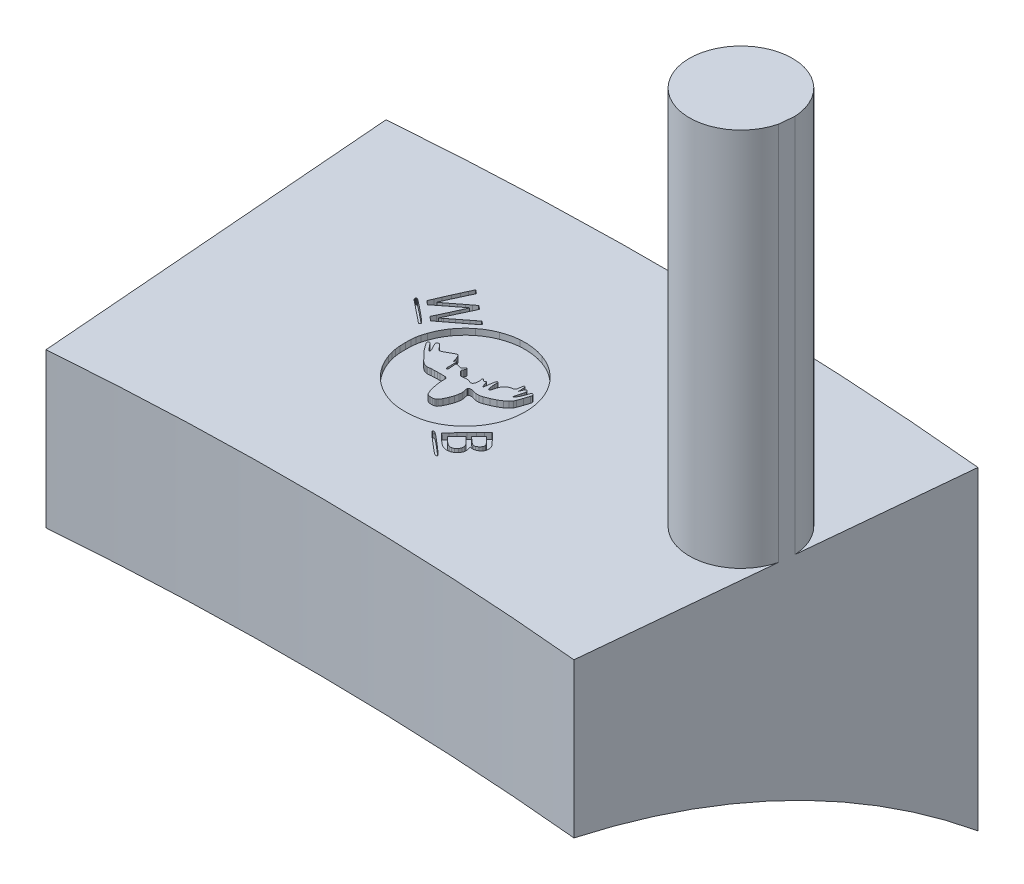
from build123d import *

# Parameters (mm, degrees)
SKETCH1_R           = 140.97
SKETCH1_R_2         = 125.73
BOSS_EXTRUDE1_DEPTH = 12.954
CUT_EXTRUDE1_START  = -12.954
CUT_EXTRUDE1_DEPTH  = 12.954
SKETCH5_R           = 2.1209
BOSS_EXTRUDE2_DEPTH = 28.575
SKETCH6_W           = 35.941656598
SKETCH6_H           = 50
CUT_EXTRUDE2_DEPTH  = 25.4
CUT_EXTRUDE3_DEPTH  = 0.25


with BuildPart() as part:
    # Sketch1 → Boss-Extrude1 (new body)
    with BuildSketch(Plane(origin=(0, 0, 0), x_dir=(1, 0, 0), z_dir=(0, 1, 0))):
        Circle(SKETCH1_R)
        Circle(SKETCH1_R_2, mode=Mode.SUBTRACT)
    extrude(amount=BOSS_EXTRUDE1_DEPTH)

    # Sketch3 → Cut-Extrude1 (cut)
    with BuildSketch(Plane(origin=(0, 12.954, 0), x_dir=(1, 0, 0), z_dir=(0, 1, 0)).offset(CUT_EXTRUDE1_START)):
        with BuildLine():
            Line((0, 0), (-11.080200404, 140.53387513))
            ThreePointArc((-11.080200404, 140.53387513), (-1.210297371, -140.964804403), (13.491584054, 140.322906397))
            Line((13.491584054, 140.322906397), (0, 0))
        make_face()
    extrude(amount=CUT_EXTRUDE1_DEPTH, mode=Mode.SUBTRACT)

    # Sketch5 → Boss-Extrude2 (add)
    with BuildSketch(Plane(origin=(0, 0, 0), x_dir=(1, 0, 0), z_dir=(0, 1, 0))):
        with Locations((10.71230924, 133.345085246)):
            Circle(SKETCH5_R)
    extrude(amount=BOSS_EXTRUDE2_DEPTH)

    # Sketch2 → Cut-Revolve1 (revolve, cut)
    with BuildSketch(Plane.XY):
        with BuildLine():
            Line((-125.73, 6.604), (-125.73, 0))
            Line((-125.73, 0), (-140.97, 0))
            ThreePointArc((-140.97, 0), (-133.78949329, 4.316215284), (-125.73, 6.604))
        make_face()
    revolve(axis=Axis((0, 0, 0), (0, 1, 0)), mode=Mode.SUBTRACT)

    # Sketch6 → Cut-Extrude2 (cut)
    with BuildSketch(Plane(origin=(0, 0, 0), x_dir=(0.09570535612916914, 0, -0.9954097070092239), z_dir=(0.995409707009224, 0, 0.09570535612916914))):
        with Locations((132.91957607, 23.563430101)):
            Rectangle(SKETCH6_W, SKETCH6_H)
    extrude(amount=CUT_EXTRUDE2_DEPTH, mode=Mode.SUBTRACT)

    # Sketch7 → Cut-Extrude3 (cut)
    # profile 1 of 5: a face of its own
    with BuildSketch(Plane(origin=(0, 12.954, 0), x_dir=(1, 0, 0), z_dir=(0, 1, 0))):
        with BuildLine():
            Line((-3.705322749, 134.849056941), (-3.634126589, 134.792668549))
            Line((-3.634126589, 134.792668549), (-3.160347996, 135.161889223))
            Line((-3.160347996, 135.161889223), (-2.977161715, 135.304652612))
            Line((-2.977161715, 135.304652612), (-2.819274394, 135.427709401))
            Line((-2.819274394, 135.427709401), (-2.681545143, 135.535061604))
            Line((-2.681545143, 135.535061604), (-2.664549669, 135.548331107))
            ThreePointArc((-2.664549669, 135.548331107), (-2.659148698, 135.548333677), (-2.657831229, 135.543095856))
            ThreePointArc((-2.657831229, 135.543095856), (-2.716026654, 135.411683388), (-2.774453274, 135.280373548))
            ThreePointArc((-2.774453274, 135.280373548), (-2.84330035, 135.127328835), (-2.913125798, 134.974728012))
            ThreePointArc((-2.913125798, 134.974728012), (-2.996713918, 134.794502631), (-3.080999908, 134.614602566))
            Line((-3.080999908, 134.614602566), (-3.169252964, 134.427181418))
            Line((-3.169252964, 134.427181418), (-3.082744205, 134.354752187))
            Line((-3.082744205, 134.354752187), (-2.996235446, 134.282322957))
            Line((-2.996235446, 134.282322957), (-2.419881036, 134.722244367))
            ThreePointArc((-2.419881036, 134.722244367), (-2.308383462, 134.807458989), (-2.196992664, 134.892813139))
            ThreePointArc((-2.196992664, 134.892813139), (-2.100802582, 134.966762842), (-2.004755402, 135.040898053))
            ThreePointArc((-2.004755402, 135.040898053), (-1.921450772, 135.105365412), (-1.838184063, 135.169881744))
            ThreePointArc((-1.838184063, 135.169881744), (-1.826822545, 135.17924269), (-1.816036102, 135.189260877))
            ThreePointArc((-1.816036102, 135.189260877), (-1.809296654, 135.197167451), (-1.804023567, 135.20611891))
            ThreePointArc((-1.804023567, 135.20611891), (-1.802331284, 135.213430449), (-1.803887086, 135.22077224))
            ThreePointArc((-1.803887086, 135.22077224), (-1.809327945, 135.230116448), (-1.816522006, 135.238188788))
            ThreePointArc((-1.816522006, 135.238188788), (-1.834417714, 135.254224445), (-1.852690135, 135.269829484))
            ThreePointArc((-1.852690135, 135.269829484), (-1.865372858, 135.28020644), (-1.878243989, 135.29034876))
            ThreePointArc((-1.878243989, 135.29034876), (-1.889989756, 135.29919486), (-1.901956271, 135.307739981))
            ThreePointArc((-1.901956271, 135.307739981), (-1.912002633, 135.314585535), (-1.922174507, 135.321243161))
            ThreePointArc((-1.922174507, 135.321243161), (-1.926080577, 135.323066893), (-1.930329315, 135.323796005))
            ThreePointArc((-1.930329315, 135.323796005), (-1.93541936, 135.323106049), (-1.939982063, 135.320746737))
            ThreePointArc((-1.939982063, 135.320746737), (-2.002559306, 135.273289257), (-2.065101319, 135.225785357))
            ThreePointArc((-2.065101319, 135.225785357), (-2.135557248, 135.171957252), (-2.205749551, 135.117785825))
            ThreePointArc((-2.205749551, 135.117785825), (-2.288060267, 135.053741944), (-2.370177709, 134.989450434))
            ThreePointArc((-2.370177709, 134.989450434), (-2.454315753, 134.923404554), (-2.538485093, 134.857398562))
            ThreePointArc((-2.538485093, 134.857398562), (-2.614951264, 134.797501817), (-2.691455274, 134.737653411))
            Line((-2.691455274, 134.737653411), (-2.818347825, 134.638541366))
            ThreePointArc((-2.818347825, 134.638541366), (-2.841702758, 134.620425916), (-2.865179269, 134.602468304))
            Line((-2.865179269, 134.602468304), (-2.933826793, 134.550324423))
            Line((-2.933826793, 134.550324423), (-2.871839825, 134.68529859))
            ThreePointArc((-2.871839825, 134.68529859), (-2.853901576, 134.72425615), (-2.835885824, 134.76317793))
            Line((-2.835885824, 134.76317793), (-2.767776986, 134.909805204))
            Line((-2.767776986, 134.909805204), (-2.687753865, 135.08175565))
            Line((-2.687753865, 135.08175565), (-2.604649551, 135.259993198))
            Line((-2.604649551, 135.259993198), (-2.399457086, 135.699689992))
            Line((-2.399457086, 135.699689992), (-2.469705309, 135.759131745))
            ThreePointArc((-2.469705309, 135.759131745), (-2.4835554, 135.770647702), (-2.497602089, 135.781923021))
            ThreePointArc((-2.497602089, 135.781923021), (-2.51033253, 135.791713922), (-2.523297134, 135.801192578))
            ThreePointArc((-2.523297134, 135.801192578), (-2.534188146, 135.808816333), (-2.545206093, 135.816255461))
            ThreePointArc((-2.545206093, 135.816255461), (-2.549168326, 135.81814077), (-2.553499159, 135.81884615))
            ThreePointArc((-2.553499159, 135.81884615), (-2.558628744, 135.818086803), (-2.56322549, 135.815686975))
            ThreePointArc((-2.56322549, 135.815686975), (-2.633699992, 135.762276212), (-2.704143397, 135.708824441))
            ThreePointArc((-2.704143397, 135.708824441), (-2.783303168, 135.648454262), (-2.862204439, 135.587746622))
            ThreePointArc((-2.862204439, 135.587746622), (-2.954849432, 135.515954249), (-3.047305436, 135.443918653))
            ThreePointArc((-3.047305436, 135.443918653), (-3.139493609, 135.372071791), (-3.23185094, 135.300442507))
            ThreePointArc((-3.23185094, 135.300442507), (-3.312973781, 135.237943632), (-3.394350982, 135.175776311))
            Line((-3.394350982, 135.175776311), (-3.528322202, 135.073862499))
            ThreePointArc((-3.528322202, 135.073862499), (-3.530734929, 135.07313885), (-3.533028228, 135.074180819))
            ThreePointArc((-3.533028228, 135.074180819), (-3.53428324, 135.07657134), (-3.533958776, 135.079251707))
            Line((-3.533958776, 135.079251707), (-3.464140959, 135.234582289))
            ThreePointArc((-3.464140959, 135.234582289), (-3.421585617, 135.328778761), (-3.378671475, 135.422812312))
            ThreePointArc((-3.378671475, 135.422812312), (-3.329420779, 135.529875573), (-3.279933201, 135.636829547))
            Line((-3.279933201, 135.636829547), (-3.02134553, 136.194077419))
            Line((-3.02134553, 136.194077419), (-3.090680372, 136.254012664))
            ThreePointArc((-3.090680372, 136.254012664), (-3.104288318, 136.265597751), (-3.118069365, 136.276976379))
            ThreePointArc((-3.118069365, 136.276976379), (-3.130419138, 136.286795346), (-3.142980655, 136.296341933))
            ThreePointArc((-3.142980655, 136.296341933), (-3.153566633, 136.30409529), (-3.164256708, 136.311704481))
            ThreePointArc((-3.164256708, 136.311704481), (-3.16763544, 136.313373722), (-3.171360022, 136.313947909))
            ThreePointArc((-3.171360022, 136.313947909), (-3.175222698, 136.312820985), (-3.177873413, 136.309793786))
            Line((-3.177873413, 136.309793786), (-3.269763803, 136.112211535))
            ThreePointArc((-3.269763803, 136.112211535), (-3.32092752, 136.001467527), (-3.371619222, 135.890506667))
            ThreePointArc((-3.371619222, 135.890506667), (-3.431189622, 135.758922808), (-3.490420605, 135.627185816))
            ThreePointArc((-3.490420605, 135.627185816), (-3.549299626, 135.495030194), (-3.607618576, 135.362626464))
            ThreePointArc((-3.607618576, 135.362626464), (-3.656483193, 135.249991703), (-3.704569703, 135.137022559))
            ThreePointArc((-3.704569703, 135.137022559), (-3.746574227, 135.037228104), (-3.788463362, 134.937385159))
            ThreePointArc((-3.788463362, 134.937385159), (-3.789644845, 134.930022177), (-3.787327306, 134.92293427))
            ThreePointArc((-3.787327306, 134.92293427), (-3.783688065, 134.917805921), (-3.779427776, 134.913180558))
            ThreePointArc((-3.779427776, 134.913180558), (-3.769174514, 134.903523136), (-3.758779625, 134.894018325))
            ThreePointArc((-3.758779625, 134.894018325), (-3.746174728, 134.88286181), (-3.733375686, 134.87192857))
            ThreePointArc((-3.733375686, 134.87192857), (-3.719430125, 134.86039352), (-3.705322749, 134.849056941))
        make_face()
    # profile 2 of 5: a face of its own
    with BuildSketch(Plane(origin=(0, 12.954, 0), x_dir=(1, 0, 0), z_dir=(0, 1, 0))):
        with BuildLine():
            Line((2.335946386, 130.532415257), (2.309368832, 130.596024339))
            Line((2.309368832, 130.596024339), (2.404672543, 130.585560291))
            ThreePointArc((2.404672543, 130.585560291), (2.448008969, 130.583769831), (2.491187442, 130.587877266))
            ThreePointArc((2.491187442, 130.587877266), (2.533564282, 130.597811455), (2.57422292, 130.613347218))
            ThreePointArc((2.57422292, 130.613347218), (2.614128208, 130.634961314), (2.650944997, 130.661496671))
            ThreePointArc((2.650944997, 130.661496671), (2.686708775, 130.694228496), (2.718838126, 130.730534487))
            ThreePointArc((2.718838126, 130.730534487), (2.733969509, 130.750629269), (2.74801809, 130.771495423))
            ThreePointArc((2.74801809, 130.771495423), (2.757136164, 130.787998593), (2.764165236, 130.805493908))
            ThreePointArc((2.764165236, 130.805493908), (2.769111119, 130.824011448), (2.771817407, 130.842986091))
            ThreePointArc((2.771817407, 130.842986091), (2.773344497, 130.869210372), (2.773619979, 130.895477635))
            ThreePointArc((2.773619979, 130.895477635), (2.772759833, 130.916159469), (2.770734702, 130.936759881))
            ThreePointArc((2.770734702, 130.936759881), (2.767410036, 130.959044917), (2.763113119, 130.981163071))
            ThreePointArc((2.763113119, 130.981163071), (2.758106921, 131.001965594), (2.752174547, 131.02252317))
            ThreePointArc((2.752174547, 131.02252317), (2.746367141, 131.038591271), (2.739185953, 131.054094187))
            ThreePointArc((2.739185953, 131.054094187), (2.717287586, 131.090229767), (2.690721807, 131.123086698))
            ThreePointArc((2.690721807, 131.123086698), (2.592426633, 131.228478429), (2.493479088, 131.333257917))
            ThreePointArc((2.493479088, 131.333257917), (2.388177952, 131.44378386), (2.282587159, 131.554033112))
            ThreePointArc((2.282587159, 131.554033112), (2.268428011, 131.563808495), (2.25157004, 131.567250647))
            ThreePointArc((2.25157004, 131.567250647), (2.247090484, 131.566358043), (2.243295201, 131.563816589))
            Line((2.243295201, 131.563816589), (2.093772156, 131.413891952))
            ThreePointArc((2.093772156, 131.413891952), (2.010221188, 131.329749051), (1.926976453, 131.245303173))
            ThreePointArc((1.926976453, 131.245303173), (1.829018897, 131.145349226), (1.731283032, 131.045178497))
            ThreePointArc((1.731283032, 131.045178497), (1.633863636, 130.944697957), (1.536858239, 130.84381768))
            ThreePointArc((1.536858239, 130.84381768), (1.455212176, 130.757981851), (1.374147358, 130.671596873))
            ThreePointArc((1.374147358, 130.671596873), (1.302808659, 130.594982255), (1.231547684, 130.518295339))
            ThreePointArc((1.231547684, 130.518295339), (1.228715686, 130.51274475), (1.22922052, 130.506533921))
            ThreePointArc((1.22922052, 130.506533921), (1.232151217, 130.500673), (1.236250836, 130.495561005))
            ThreePointArc((1.236250836, 130.495561005), (1.265276066, 130.466421967), (1.294381493, 130.437363032))
            ThreePointArc((1.294381493, 130.437363032), (1.328355225, 130.403801226), (1.362591167, 130.370506938))
            ThreePointArc((1.362591167, 130.370506938), (1.402373559, 130.332316835), (1.442350507, 130.294330437))
            ThreePointArc((1.442350507, 130.294330437), (1.521848226, 130.221328603), (1.603427718, 130.150660777))
            ThreePointArc((1.603427718, 130.150660777), (1.661031646, 130.106499752), (1.722394759, 130.067731504))
            ThreePointArc((1.722394759, 130.067731504), (1.77376172, 130.042719104), (1.827938544, 130.024579187))
            ThreePointArc((1.827938544, 130.024579187), (1.883996554, 130.013623643), (1.941002271, 130.010035784))
            ThreePointArc((1.941002271, 130.010035784), (1.963533572, 130.010675147), (1.986000631, 130.012491622))
            ThreePointArc((1.986000631, 130.012491622), (2.010070047, 130.015584443), (2.03398864, 130.01968362))
            ThreePointArc((2.03398864, 130.01968362), (2.056663325, 130.024568389), (2.079107226, 130.030422757))
            ThreePointArc((2.079107226, 130.030422757), (2.09735732, 130.036355934), (2.115108927, 130.043646267))
            ThreePointArc((2.115108927, 130.043646267), (2.148059247, 130.061185288), (2.178596864, 130.082651418))
            ThreePointArc((2.178596864, 130.082651418), (2.215063858, 130.113633203), (2.24962219, 130.146730548))
            ThreePointArc((2.24962219, 130.146730548), (2.281607235, 130.18123038), (2.311493501, 130.217563459))
            ThreePointArc((2.311493501, 130.217563459), (2.330465585, 130.246215265), (2.345014512, 130.277347158))
            ThreePointArc((2.345014512, 130.277347158), (2.35364471, 130.305134714), (2.358761057, 130.333778241))
            ThreePointArc((2.358761057, 130.333778241), (2.361416451, 130.3681767), (2.361485094, 130.402677431))
            ThreePointArc((2.361485094, 130.402677431), (2.358930096, 130.43779288), (2.353779371, 130.472622361))
            ThreePointArc((2.353779371, 130.472622361), (2.346447858, 130.502991523), (2.335946386, 130.532415257))
        make_face()
        with BuildLine():
            Line((2.09650021, 130.885826141), (1.973628318, 131.001626652))
            Line((1.973628318, 131.001626652), (2.016395962, 131.050769077))
            ThreePointArc((2.016395962, 131.050769077), (2.051337182, 131.090177316), (2.087000561, 131.128933237))
            ThreePointArc((2.087000561, 131.128933237), (2.129160629, 131.173380489), (2.171841342, 131.21732803))
            ThreePointArc((2.171841342, 131.21732803), (2.215204993, 131.261333373), (2.258690635, 131.305218169))
            ThreePointArc((2.258690635, 131.305218169), (2.264700287, 131.309254456), (2.271799364, 131.310672418))
            ThreePointArc((2.271799364, 131.310672418), (2.275742106, 131.309923313), (2.279135375, 131.307780396))
            ThreePointArc((2.279135375, 131.307780396), (2.298697416, 131.289439265), (2.318179783, 131.271013524))
            ThreePointArc((2.318179783, 131.271013524), (2.340698195, 131.249353418), (2.362943141, 131.227412556))
            ThreePointArc((2.362943141, 131.227412556), (2.388541194, 131.201640097), (2.413931992, 131.175663427))
            ThreePointArc((2.413931992, 131.175663427), (2.47456052, 131.110071795), (2.53198688, 131.041659123))
            ThreePointArc((2.53198688, 131.041659123), (2.558135178, 130.999358305), (2.57340656, 130.952030959))
            ThreePointArc((2.57340656, 130.952030959), (2.573698192, 130.911851785), (2.559507846, 130.87426076))
            ThreePointArc((2.559507846, 130.87426076), (2.527310107, 130.828951161), (2.488882764, 130.788789072))
            ThreePointArc((2.488882764, 130.788789072), (2.448321254, 130.758066595), (2.403077964, 130.734782451))
            ThreePointArc((2.403077964, 130.734782451), (2.362793058, 130.725307263), (2.321556939, 130.728805168))
            ThreePointArc((2.321556939, 130.728805168), (2.272395823, 130.74650711), (2.227905298, 130.773907241))
            ThreePointArc((2.227905298, 130.773907241), (2.160795261, 130.828214139), (2.09650021, 130.885826141))
        make_face(mode=Mode.SUBTRACT)
        with BuildLine():
            Line((1.608075251, 130.373386998), (1.47366335, 130.502226889))
            Line((1.47366335, 130.502226889), (1.665668252, 130.695587312))
            Line((1.665668252, 130.695587312), (1.85767323, 130.888947774))
            Line((1.85767323, 130.888947774), (1.965556938, 130.783670016))
            ThreePointArc((1.965556938, 130.783670016), (1.988333684, 130.761079939), (2.010741039, 130.738123412))
            ThreePointArc((2.010741039, 130.738123412), (2.034185105, 130.713379009), (2.057292449, 130.688319873))
            ThreePointArc((2.057292449, 130.688319873), (2.078136199, 130.665089613), (2.098660506, 130.641576646))
            ThreePointArc((2.098660506, 130.641576646), (2.112823257, 130.624500264), (2.126348042, 130.606914289))
            ThreePointArc((2.126348042, 130.606914289), (2.154041134, 130.560672751), (2.17223968, 130.509938146))
            ThreePointArc((2.17223968, 130.509938146), (2.178810975, 130.459652494), (2.173556842, 130.409212204))
            ThreePointArc((2.173556842, 130.409212204), (2.15635814, 130.359030252), (2.128666025, 130.313784584))
            ThreePointArc((2.128666025, 130.313784584), (2.088669818, 130.269679109), (2.04231946, 130.232307544))
            ThreePointArc((2.04231946, 130.232307544), (1.997906914, 130.208591409), (1.949382298, 130.195164161))
            ThreePointArc((1.949382298, 130.195164161), (1.900283624, 130.193138123), (1.852080906, 130.202692313))
            ThreePointArc((1.852080906, 130.202692313), (1.794663546, 130.226718162), (1.741950822, 130.259814435))
            ThreePointArc((1.741950822, 130.259814435), (1.673288951, 130.314568422), (1.608075251, 130.373386998))
        make_face(mode=Mode.SUBTRACT)
    # profile 3 of 5: a face of its own
    with BuildSketch(Plane(origin=(0, 12.954, 0), x_dir=(1, 0, 0), z_dir=(0, 1, 0))):
        with BuildLine():
            ThreePointArc((-0.478163902, 135.451211087), (-0.832196614, 135.396802924), (-1.174314339, 135.290713945))
            ThreePointArc((-1.174314339, 135.290713945), (-1.499897181, 135.134586011), (-1.799566273, 134.933144819))
            ThreePointArc((-1.799566273, 134.933144819), (-2.067166133, 134.69051804), (-2.29700334, 134.411856423))
            ThreePointArc((-2.29700334, 134.411856423), (-2.482397083, 134.104962374), (-2.620553748, 133.774103594))
            ThreePointArc((-2.620553748, 133.774103594), (-2.652636616, 133.672719633), (-2.681633736, 133.570410371))
            ThreePointArc((-2.681633736, 133.570410371), (-2.701872906, 133.485459703), (-2.717471978, 133.399535849))
            ThreePointArc((-2.717471978, 133.399535849), (-2.728871598, 133.310002112), (-2.735638285, 133.219999594))
            ThreePointArc((-2.735638285, 133.219999594), (-2.739936879, 133.103832239), (-2.741386884, 132.987594423))
            ThreePointArc((-2.741386884, 132.987594423), (-2.739612552, 132.869476936), (-2.734239659, 132.751468373))
            ThreePointArc((-2.734239659, 132.751468373), (-2.725667506, 132.651200798), (-2.712184909, 132.551474733))
            ThreePointArc((-2.712184909, 132.551474733), (-2.694493464, 132.456934765), (-2.671900459, 132.363444932))
            ThreePointArc((-2.671900459, 132.363444932), (-2.642716818, 132.263312613), (-2.609470226, 132.164454985))
            ThreePointArc((-2.609470226, 132.164454985), (-2.499781383, 131.905783625), (-2.361759947, 131.661053981))
            ThreePointArc((-2.361759947, 131.661053981), (-2.196923821, 131.432878792), (-2.007670003, 131.224509269))
            ThreePointArc((-2.007670003, 131.224509269), (-1.797128232, 131.039309846), (-1.567170962, 130.878853254))
            ThreePointArc((-1.567170962, 130.878853254), (-1.322686887, 130.746722358), (-1.064628428, 130.643587162))
            ThreePointArc((-1.064628428, 130.643587162), (-0.967352396, 130.613024117), (-0.869030926, 130.58601273))
            ThreePointArc((-0.869030926, 130.58601273), (-0.779102808, 130.565385207), (-0.688272992, 130.54918318))
            ThreePointArc((-0.688272992, 130.54918318), (-0.593644862, 130.536942329), (-0.498547668, 130.529142001))
            ThreePointArc((-0.498547668, 130.529142001), (-0.386869757, 130.524243932), (-0.275096418, 130.52261071))
            ThreePointArc((-0.275096418, 130.52261071), (-0.026318267, 130.533992849), (0.220381216, 130.56804408))
            ThreePointArc((0.220381216, 130.56804408), (0.451881811, 130.623520564), (0.676321172, 130.702875079))
            ThreePointArc((0.676321172, 130.702875079), (0.890810324, 130.805064869), (1.093421652, 130.929149514))
            ThreePointArc((1.093421652, 130.929149514), (1.290879506, 131.078712437), (1.47366335, 131.245891198))
            ThreePointArc((1.47366335, 131.245891198), (1.630567102, 131.418122692), (1.771429406, 131.603703633))
            ThreePointArc((1.771429406, 131.603703633), (1.891273566, 131.796544655), (1.991918332, 132.00006594))
            ThreePointArc((1.991918332, 132.00006594), (2.072576187, 132.212711466), (2.132344697, 132.432146044))
            ThreePointArc((2.132344697, 132.432146044), (2.172707651, 132.662718817), (2.192502341, 132.895959341))
            ThreePointArc((2.192502341, 132.895959341), (2.158400825, 133.415036137), (2.015890216, 133.91533041))
            ThreePointArc((2.015890216, 133.91533041), (1.771362965, 134.374367415), (1.435716786, 134.771671067))
            ThreePointArc((1.435716786, 134.771671067), (1.023249238, 135.090238317), (0.553133934, 135.315196475))
            ThreePointArc((0.553133934, 135.315196475), (0.044635512, 135.437420686), (-0.478163902, 135.451211087))
        make_face()
        with BuildLine():
            Line((1.317883636, 133.728388796), (1.327047219, 133.57405895))
            Line((1.327047219, 133.57405895), (1.361694562, 133.665692843))
            ThreePointArc((1.361694562, 133.665692843), (1.380423856, 133.712968368), (1.400629237, 133.759632105))
            ThreePointArc((1.400629237, 133.759632105), (1.412841844, 133.779536966), (1.429631282, 133.795768602))
            ThreePointArc((1.429631282, 133.795768602), (1.443775304, 133.800534829), (1.457989499, 133.795982148))
            ThreePointArc((1.457989499, 133.795982148), (1.475700354, 133.780445011), (1.490245543, 133.761910868))
            ThreePointArc((1.490245543, 133.761910868), (1.49772684, 133.747806897), (1.502712863, 133.732640112))
            ThreePointArc((1.502712863, 133.732640112), (1.505181933, 133.716551964), (1.505046827, 133.700276012))
            ThreePointArc((1.505046827, 133.700276012), (1.501935294, 133.675951412), (1.496955412, 133.651939569))
            ThreePointArc((1.496955412, 133.651939569), (1.484716204, 133.603764821), (1.471931594, 133.555731933))
            ThreePointArc((1.471931594, 133.555731933), (1.445764659, 133.459029329), (1.419895886, 133.362246537))
            ThreePointArc((1.419895886, 133.362246537), (1.412166515, 133.329825502), (1.4061064, 133.297051402))
            ThreePointArc((1.4061064, 133.297051402), (1.406447734, 133.285595058), (1.41095155, 133.27505561))
            ThreePointArc((1.41095155, 133.27505561), (1.418115987, 133.270025868), (1.426802953, 133.271104782))
            ThreePointArc((1.426802953, 133.271104782), (1.448171255, 133.286512271), (1.464724996, 133.307005409))
            ThreePointArc((1.464724996, 133.307005409), (1.492183822, 133.354147431), (1.51785903, 133.402284122))
            ThreePointArc((1.51785903, 133.402284122), (1.545142383, 133.458801266), (1.569967723, 133.516440414))
            ThreePointArc((1.569967723, 133.516440414), (1.591713666, 133.573838806), (1.610795935, 133.63217686))
            ThreePointArc((1.610795935, 133.63217686), (1.619064543, 133.658065003), (1.628159226, 133.683674622))
            ThreePointArc((1.628159226, 133.683674622), (1.637178974, 133.706286215), (1.647197111, 133.728473529))
            ThreePointArc((1.647197111, 133.728473529), (1.656040095, 133.746019659), (1.665592267, 133.763190012))
            ThreePointArc((1.665592267, 133.763190012), (1.671292958, 133.769997008), (1.678928947, 133.774527434))
            ThreePointArc((1.678928947, 133.774527434), (1.6917282, 133.777415826), (1.704819908, 133.776537834))
            ThreePointArc((1.704819908, 133.776537834), (1.718626076, 133.771987568), (1.731151707, 133.764610319))
            ThreePointArc((1.731151707, 133.764610319), (1.742100904, 133.754550036), (1.750739219, 133.742447403))
            ThreePointArc((1.750739219, 133.742447403), (1.755953765, 133.729652756), (1.757731159, 133.7159511))
            ThreePointArc((1.757731159, 133.7159511), (1.755104509, 133.682110025), (1.74728749, 133.649079556))
            ThreePointArc((1.74728749, 133.649079556), (1.712158324, 133.540732672), (1.676231173, 133.432647773))
            ThreePointArc((1.676231173, 133.432647773), (1.640043035, 133.326719693), (1.602881065, 133.221129317))
            ThreePointArc((1.602881065, 133.221129317), (1.586105371, 133.181213031), (1.565060481, 133.143373284))
            ThreePointArc((1.565060481, 133.143373284), (1.524272128, 133.086614306), (1.476909493, 133.035213409))
            ThreePointArc((1.476909493, 133.035213409), (1.415622768, 132.980599152), (1.350399729, 132.930752036))
            ThreePointArc((1.350399729, 132.930752036), (1.270483989, 132.878084255), (1.187345125, 132.830667485))
            ThreePointArc((1.187345125, 132.830667485), (1.088668623, 132.781151613), (0.987996468, 132.735830636))
            ThreePointArc((0.987996468, 132.735830636), (0.88548413, 132.693782349), (0.781935504, 132.654354952))
            ThreePointArc((0.781935504, 132.654354952), (0.71947815, 132.635375047), (0.655289002, 132.623504444))
            ThreePointArc((0.655289002, 132.623504444), (0.596818557, 132.620153032), (0.538448023, 132.624939009))
            ThreePointArc((0.538448023, 132.624939009), (0.457879433, 132.639406893), (0.378184239, 132.658096284))
            ThreePointArc((0.378184239, 132.658096284), (0.345223657, 132.666377818), (0.312096101, 132.673963907))
            ThreePointArc((0.312096101, 132.673963907), (0.290739747, 132.677780032), (0.269156305, 132.679973592))
            ThreePointArc((0.269156305, 132.679973592), (0.252809693, 132.680062782), (0.236562824, 132.678257542))
            ThreePointArc((0.236562824, 132.678257542), (0.221225906, 132.674611151), (0.206487768, 132.669016107))
            ThreePointArc((0.206487768, 132.669016107), (0.193403845, 132.662432211), (0.180867901, 132.654856801))
            ThreePointArc((0.180867901, 132.654856801), (0.174058893, 132.648778571), (0.169295636, 132.640992761))
            ThreePointArc((0.169295636, 132.640992761), (0.166672513, 132.631652457), (0.166514566, 132.62195209))
            ThreePointArc((0.166514566, 132.62195209), (0.168881611, 132.605092096), (0.172155585, 132.58838451))
            ThreePointArc((0.172155585, 132.58838451), (0.184845815, 132.529818121), (0.196699052, 132.471076614))
            ThreePointArc((0.196699052, 132.471076614), (0.202553587, 132.435352344), (0.206288444, 132.399344708))
            ThreePointArc((0.206288444, 132.399344708), (0.207421722, 132.367713403), (0.20615002, 132.336087361))
            ThreePointArc((0.20615002, 132.336087361), (0.202219164, 132.29521783), (0.196844605, 132.254512986))
            ThreePointArc((0.196844605, 132.254512986), (0.182518167, 132.177935428), (0.162724173, 132.102585795))
            ThreePointArc((0.162724173, 132.102585795), (0.134598392, 132.01652259), (0.102545032, 131.931843686))
            ThreePointArc((0.102545032, 131.931843686), (0.067216955, 131.850111385), (0.028147425, 131.77010005))
            ThreePointArc((0.028147425, 131.77010005), (-0.00808011, 131.706670794), (-0.049449108, 131.646468544))
            ThreePointArc((-0.049449108, 131.646468544), (-0.062366735, 131.630608459), (-0.07650695, 131.615828009))
            ThreePointArc((-0.07650695, 131.615828009), (-0.089156916, 131.605355657), (-0.103249311, 131.596923801))
            ThreePointArc((-0.103249311, 131.596923801), (-0.120035158, 131.58984014), (-0.13758505, 131.584946858))
            ThreePointArc((-0.13758505, 131.584946858), (-0.16392466, 131.579956806), (-0.190450392, 131.576075922))
            ThreePointArc((-0.190450392, 131.576075922), (-0.212044451, 131.573904488), (-0.233718003, 131.572775025))
            ThreePointArc((-0.233718003, 131.572775025), (-0.257440179, 131.572548768), (-0.281154553, 131.573197811))
            ThreePointArc((-0.281154553, 131.573197811), (-0.303757983, 131.57466085), (-0.326290329, 131.576973616))
            ThreePointArc((-0.326290329, 131.576973616), (-0.344344787, 131.579824092), (-0.3621517, 131.583947504))
            ThreePointArc((-0.3621517, 131.583947504), (-0.384096556, 131.590803647), (-0.405427009, 131.599382407))
            ThreePointArc((-0.405427009, 131.599382407), (-0.420033207, 131.607755033), (-0.432721967, 131.618820169))
            ThreePointArc((-0.432721967, 131.618820169), (-0.445317291, 131.634229738), (-0.455636528, 131.651247681))
            ThreePointArc((-0.455636528, 131.651247681), (-0.471804959, 131.683740796), (-0.487103704, 131.71665233))
            ThreePointArc((-0.487103704, 131.71665233), (-0.513711365, 131.782879322), (-0.53496786, 131.8510126))
            ThreePointArc((-0.53496786, 131.8510126), (-0.559099142, 131.946679287), (-0.580249831, 132.043048796))
            ThreePointArc((-0.580249831, 132.043048796), (-0.598629563, 132.141332556), (-0.613922791, 132.240143634))
            ThreePointArc((-0.613922791, 132.240143634), (-0.621865641, 132.316412015), (-0.624588455, 132.393044521))
            ThreePointArc((-0.624588455, 132.393044521), (-0.626504045, 132.459346627), (-0.632060599, 132.52544325))
            ThreePointArc((-0.632060599, 132.52544325), (-0.641871144, 132.554412405), (-0.662872493, 132.576647559))
            ThreePointArc((-0.662872493, 132.576647559), (-0.694738389, 132.59234718), (-0.729714274, 132.598560146))
            ThreePointArc((-0.729714274, 132.598560146), (-0.829973072, 132.601068267), (-0.930261775, 132.601610019))
            ThreePointArc((-0.930261775, 132.601610019), (-0.984206506, 132.601109532), (-1.038143794, 132.600083122))
            ThreePointArc((-1.038143794, 132.600083122), (-1.0954259, 132.598480572), (-1.152693072, 132.596412037))
            ThreePointArc((-1.152693072, 132.596412037), (-1.205081109, 132.594090796), (-1.257448318, 132.59133943))
            ThreePointArc((-1.257448318, 132.59133943), (-1.294509623, 132.588824225), (-1.331505538, 132.585482244))
            ThreePointArc((-1.331505538, 132.585482244), (-1.373873283, 132.581602408), (-1.416309738, 132.578564932))
            ThreePointArc((-1.416309738, 132.578564932), (-1.442407853, 132.577990213), (-1.468469911, 132.579477177))
            ThreePointArc((-1.468469911, 132.579477177), (-1.490570418, 132.582791237), (-1.512203597, 132.58839668))
            ThreePointArc((-1.512203597, 132.58839668), (-1.538416883, 132.597478929), (-1.564088169, 132.607995994))
            ThreePointArc((-1.564088169, 132.607995994), (-1.58355391, 132.617500219), (-1.602247638, 132.628445078))
            ThreePointArc((-1.602247638, 132.628445078), (-1.625019481, 132.643573972), (-1.647200199, 132.659556966))
            ThreePointArc((-1.647200199, 132.659556966), (-1.669668019, 132.677072068), (-1.691463352, 132.695417237))
            ThreePointArc((-1.691463352, 132.695417237), (-1.710147204, 132.712641869), (-1.727896893, 132.730827654))
            ThreePointArc((-1.727896893, 132.730827654), (-1.748010498, 132.752368882), (-1.768306516, 132.773738328))
            ThreePointArc((-1.768306516, 132.773738328), (-1.797823693, 132.804462952), (-1.827430827, 132.8351009))
            ThreePointArc((-1.827430827, 132.8351009), (-1.860172322, 132.868784812), (-1.893011765, 132.902373238))
            ThreePointArc((-1.893011765, 132.902373238), (-1.924368359, 132.934243878), (-1.955832434, 132.966008414))
            ThreePointArc((-1.955832434, 132.966008414), (-2.013636739, 133.027072851), (-2.068399058, 133.090879523))
            ThreePointArc((-2.068399058, 133.090879523), (-2.129366464, 133.167900917), (-2.187943511, 133.246755526))
            ThreePointArc((-2.187943511, 133.246755526), (-2.240959871, 133.322028401), (-2.292467342, 133.398341706))
            ThreePointArc((-2.292467342, 133.398341706), (-2.306167329, 133.427607674), (-2.310866494, 133.459578041))
            ThreePointArc((-2.310866494, 133.459578041), (-2.31026376, 133.46552693), (-2.308480041, 133.471234024))
            ThreePointArc((-2.308480041, 133.471234024), (-2.305361103, 133.477364819), (-2.301454361, 133.483026249))
            ThreePointArc((-2.301454361, 133.483026249), (-2.296585662, 133.48842292), (-2.291074727, 133.493161896))
            ThreePointArc((-2.291074727, 133.493161896), (-2.285188765, 133.496991427), (-2.278825206, 133.499960431))
            ThreePointArc((-2.278825206, 133.499960431), (-2.265168193, 133.502310476), (-2.251649301, 133.499264774))
            ThreePointArc((-2.251649301, 133.499264774), (-2.235746553, 133.490423993), (-2.221678691, 133.478884838))
            ThreePointArc((-2.221678691, 133.478884838), (-2.197478636, 133.453764838), (-2.174685051, 133.427362005))
            ThreePointArc((-2.174685051, 133.427362005), (-2.115493864, 133.354580063), (-2.056608299, 133.281550631))
            ThreePointArc((-2.056608299, 133.281550631), (-2.012155082, 133.229810146), (-1.964357465, 133.181142351))
            ThreePointArc((-1.964357465, 133.181142351), (-1.945853714, 133.17760983), (-1.934993223, 133.193001947))
            ThreePointArc((-1.934993223, 133.193001947), (-1.938563911, 133.237093767), (-1.952746952, 133.278994599))
            ThreePointArc((-1.952746952, 133.278994599), (-1.999629133, 133.373227089), (-2.048849318, 133.466259741))
            ThreePointArc((-2.048849318, 133.466259741), (-2.0694291, 133.506242287), (-2.088086434, 133.547157263))
            ThreePointArc((-2.088086434, 133.547157263), (-2.095447713, 133.571736151), (-2.097109961, 133.597339805))
            ThreePointArc((-2.097109961, 133.597339805), (-2.092416895, 133.615214095), (-2.080886189, 133.629655631))
            ThreePointArc((-2.080886189, 133.629655631), (-2.061571083, 133.642250917), (-2.03996242, 133.650299531))
            ThreePointArc((-2.03996242, 133.650299531), (-2.027599555, 133.652675391), (-2.015048527, 133.653653558))
            ThreePointArc((-2.015048527, 133.653653558), (-2.00477682, 133.652836997), (-1.994878161, 133.649974959))
            ThreePointArc((-1.994878161, 133.649974959), (-1.984934127, 133.644909712), (-1.976038629, 133.638170968))
            ThreePointArc((-1.976038629, 133.638170968), (-1.965092095, 133.627504481), (-1.95493058, 133.616087646))
            ThreePointArc((-1.95493058, 133.616087646), (-1.943612038, 133.602399899), (-1.932315899, 133.588693657))
            Line((-1.932315899, 133.588693657), (-1.907568774, 133.558616496))
            Line((-1.907568774, 133.558616496), (-1.876651079, 133.520966939))
            Line((-1.876651079, 133.520966939), (-1.847196209, 133.485024214))
            ThreePointArc((-1.847196209, 133.485024214), (-1.831445679, 133.466566084), (-1.814953838, 133.448767181))
            ThreePointArc((-1.814953838, 133.448767181), (-1.800550996, 133.434890074), (-1.785180958, 133.422092502))
            ThreePointArc((-1.785180958, 133.422092502), (-1.772361646, 133.41307533), (-1.758782632, 133.405248801))
            ThreePointArc((-1.758782632, 133.405248801), (-1.748323269, 133.401336629), (-1.737234111, 133.400019847))
            ThreePointArc((-1.737234111, 133.400019847), (-1.724221302, 133.40141729), (-1.711788166, 133.405504243))
            ThreePointArc((-1.711788166, 133.405504243), (-1.677857721, 133.421066581), (-1.644152825, 133.437111565))
            ThreePointArc((-1.644152825, 133.437111565), (-1.603955266, 133.457098777), (-1.564165075, 133.477885145))
            ThreePointArc((-1.564165075, 133.477885145), (-1.520399092, 133.501721205), (-1.476986299, 133.526194629))
            ThreePointArc((-1.476986299, 133.526194629), (-1.420549147, 133.558163287), (-1.363778943, 133.589536702))
            ThreePointArc((-1.363778943, 133.589536702), (-1.330040905, 133.606930171), (-1.295519659, 133.622712175))
            ThreePointArc((-1.295519659, 133.622712175), (-1.273288978, 133.631227963), (-1.250457301, 133.63796861))
            ThreePointArc((-1.250457301, 133.63796861), (-1.236828466, 133.63885203), (-1.223785957, 133.634800052))
            ThreePointArc((-1.223785957, 133.634800052), (-1.207072406, 133.622904168), (-1.194117432, 133.606997455))
            ThreePointArc((-1.194117432, 133.606997455), (-1.175971937, 133.575429068), (-1.159584201, 133.542913468))
            ThreePointArc((-1.159584201, 133.542913468), (-1.143128734, 133.505107545), (-1.128883626, 133.466414559))
            ThreePointArc((-1.128883626, 133.466414559), (-1.117811217, 133.429210418), (-1.109338248, 133.391329615))
            ThreePointArc((-1.109338248, 133.391329615), (-1.104414709, 133.36934646), (-1.097970549, 133.347760048))
            ThreePointArc((-1.097970549, 133.347760048), (-1.091369929, 133.332609799), (-1.082276832, 133.318810748))
            ThreePointArc((-1.082276832, 133.318810748), (-1.076742434, 133.315998526), (-1.071010445, 133.318382317))
            ThreePointArc((-1.071010445, 133.318382317), (-1.06628052, 133.325953299), (-1.064628428, 133.33472613))
            ThreePointArc((-1.064628428, 133.33472613), (-1.063930539, 133.340484804), (-1.061877268, 133.345910064))
            ThreePointArc((-1.061877268, 133.345910064), (-1.058517041, 133.35093982), (-1.054168925, 133.355144992))
            ThreePointArc((-1.054168925, 133.355144992), (-1.048550227, 133.358734428), (-1.042361507, 133.361215065))
            ThreePointArc((-1.042361507, 133.361215065), (-1.035242969, 133.362774757), (-1.027974395, 133.36329826))
            ThreePointArc((-1.027974395, 133.36329826), (-1.01684244, 133.360865741), (-1.007739775, 133.354011613))
            ThreePointArc((-1.007739775, 133.354011613), (-1.000526897, 133.34281663), (-0.996635197, 133.330080543))
            ThreePointArc((-0.996635197, 133.330080543), (-0.993407088, 133.303712459), (-0.992128639, 133.277178291))
            ThreePointArc((-0.992128639, 133.277178291), (-0.991522416, 133.205695565), (-0.991320363, 133.134210555))
            ThreePointArc((-0.991320363, 133.134210555), (-0.991118579, 133.06265138), (-0.990513351, 132.99109448))
            ThreePointArc((-0.990513351, 132.99109448), (-0.989234714, 132.964598339), (-0.986003695, 132.938268871))
            ThreePointArc((-0.986003695, 132.938268871), (-0.98210263, 132.925554946), (-0.974869666, 132.914394908))
            ThreePointArc((-0.974869666, 132.914394908), (-0.965730857, 132.907550636), (-0.954574346, 132.905122849))
            ThreePointArc((-0.954574346, 132.905122849), (-0.943992116, 132.907032524), (-0.934744899, 132.912520641))
            ThreePointArc((-0.934744899, 132.912520641), (-0.928043905, 132.92087497), (-0.924728122, 132.931058473))
            ThreePointArc((-0.924728122, 132.931058473), (-0.922906707, 132.951803778), (-0.923023123, 132.972628563))
            ThreePointArc((-0.923023123, 132.972628563), (-0.926238806, 133.030520046), (-0.929838452, 133.088388922))
            Line((-0.929838452, 133.088388922), (-0.941849129, 133.271663178))
            Line((-0.941849129, 133.271663178), (-0.895581021, 133.271663178))
            ThreePointArc((-0.895581021, 133.271663178), (-0.884001538, 133.271198317), (-0.872496583, 133.269806725))
            ThreePointArc((-0.872496583, 133.269806725), (-0.856211679, 133.266930183), (-0.84001596, 133.263587837))
            ThreePointArc((-0.84001596, 133.263587837), (-0.822255533, 133.259392298), (-0.804620663, 133.254696906))
            ThreePointArc((-0.804620663, 133.254696906), (-0.787923099, 133.249704114), (-0.771396165, 133.244172654))
            ThreePointArc((-0.771396165, 133.244172654), (-0.756282085, 133.238874345), (-0.741146765, 133.23363702))
            ThreePointArc((-0.741146765, 133.23363702), (-0.72798294, 133.229156764), (-0.714791837, 133.22475747))
            ThreePointArc((-0.714791837, 133.22475747), (-0.703421877, 133.221018407), (-0.692043593, 133.217304753))
            ThreePointArc((-0.692043593, 133.217304753), (-0.690103884, 133.216838752), (-0.688115142, 133.216682129))
            ThreePointArc((-0.688115142, 133.216682129), (-0.686344481, 133.217108091), (-0.684961282, 133.218292762))
            ThreePointArc((-0.684961282, 133.218292762), (-0.678789684, 133.226886211), (-0.672681136, 133.235524593))
            ThreePointArc((-0.672681136, 133.235524593), (-0.665593387, 133.245819733), (-0.658690146, 133.256239491))
            ThreePointArc((-0.658690146, 133.256239491), (-0.650829016, 133.268488989), (-0.64310705, 133.280826686))
            ThreePointArc((-0.64310705, 133.280826686), (-0.628036745, 133.30195541), (-0.610316755, 133.320916925))
            ThreePointArc((-0.610316755, 133.320916925), (-0.592828509, 133.334043101), (-0.572908639, 133.343061642))
            ThreePointArc((-0.572908639, 133.343061642), (-0.558893743, 133.344392188), (-0.545657612, 133.33959714))
            ThreePointArc((-0.545657612, 133.33959714), (-0.536477976, 133.329774919), (-0.533144951, 133.316750608))
            ThreePointArc((-0.533144951, 133.316750608), (-0.533718415, 133.308955039), (-0.535426463, 133.301327305))
            ThreePointArc((-0.535426463, 133.301327305), (-0.539630618, 133.288144898), (-0.544228343, 133.275094546))
            ThreePointArc((-0.544228343, 133.275094546), (-0.550096441, 133.259930817), (-0.556431863, 133.244956317))
            ThreePointArc((-0.556431863, 133.244956317), (-0.563441015, 133.229663005), (-0.570875547, 133.214571904))
            Line((-0.570875547, 133.214571904), (-0.608606332, 133.140613446))
            Line((-0.608606332, 133.140613446), (-0.541483157, 133.058698464))
            ThreePointArc((-0.541483157, 133.058698464), (-0.506493836, 133.017691644), (-0.46989992, 132.978110119))
            ThreePointArc((-0.46989992, 132.978110119), (-0.446465622, 132.957922964), (-0.419683932, 132.942449484))
            ThreePointArc((-0.419683932, 132.942449484), (-0.393638568, 132.934096491), (-0.366354312, 132.932172224))
            ThreePointArc((-0.366354312, 132.932172224), (-0.327334533, 132.935780441), (-0.288764047, 132.942699977))
            ThreePointArc((-0.288764047, 132.942699977), (-0.250530312, 132.949899286), (-0.211895353, 132.954480602))
            ThreePointArc((-0.211895353, 132.954480602), (-0.17700305, 132.955771115), (-0.142143718, 132.953779813))
            ThreePointArc((-0.142143718, 132.953779813), (-0.109077846, 132.948658977), (-0.07668121, 132.940290414))
            ThreePointArc((-0.07668121, 132.940290414), (-0.044093214, 132.928505628), (-0.012685651, 132.913862417))
            ThreePointArc((-0.012685651, 132.913862417), (0.002641958, 132.906306162), (0.018299286, 132.899459215))
            ThreePointArc((0.018299286, 132.899459215), (0.028149989, 132.896474577), (0.038387437, 132.895407313))
            ThreePointArc((0.038387437, 132.895407313), (0.047884414, 132.896378598), (0.056936687, 132.899410483))
            ThreePointArc((0.056936687, 132.899410483), (0.069458883, 132.905777247), (0.081482573, 132.913041678))
            ThreePointArc((0.081482573, 132.913041678), (0.10393188, 132.93257484), (0.120307698, 132.957421336))
            ThreePointArc((0.120307698, 132.957421336), (0.135376067, 132.994266749), (0.14603925, 133.032619541))
            ThreePointArc((0.14603925, 133.032619541), (0.152843759, 133.075502058), (0.154873587, 133.118873609))
            ThreePointArc((0.154873587, 133.118873609), (0.151710336, 133.158743671), (0.14296438, 133.197771049))
            ThreePointArc((0.14296438, 133.197771049), (0.136958614, 133.218783047), (0.131488149, 133.239940726))
            ThreePointArc((0.131488149, 133.239940726), (0.12946424, 133.251619705), (0.129059801, 133.263465852))
            ThreePointArc((0.129059801, 133.263465852), (0.130427709, 133.271547712), (0.133872989, 133.278985298))
            ThreePointArc((0.133872989, 133.278985298), (0.139364511, 133.285839871), (0.146203882, 133.291350316))
            ThreePointArc((0.146203882, 133.291350316), (0.153033589, 133.294634049), (0.160452624, 133.296178623))
            ThreePointArc((0.160452624, 133.296178623), (0.16789637, 133.295851912), (0.175016279, 133.293655781))
            ThreePointArc((0.175016279, 133.293655781), (0.183459511, 133.288915258), (0.190982135, 133.282818467))
            ThreePointArc((0.190982135, 133.282818467), (0.200683848, 133.272910859), (0.209772623, 133.262438128))
            ThreePointArc((0.209772623, 133.262438128), (0.221309128, 133.248747656), (0.233264981, 133.235421833))
            ThreePointArc((0.233264981, 133.235421833), (0.23914524, 133.230751565), (0.246158183, 133.22806689))
            ThreePointArc((0.246158183, 133.22806689), (0.252714837, 133.228079422), (0.258670954, 133.230820689))
            ThreePointArc((0.258670954, 133.230820689), (0.268660576, 133.238913639), (0.278062568, 133.247682387))
            ThreePointArc((0.278062568, 133.247682387), (0.290150553, 133.25741006), (0.304039392, 133.264327222))
            ThreePointArc((0.304039392, 133.264327222), (0.314575396, 133.264818097), (0.323461356, 133.259135838))
            ThreePointArc((0.323461356, 133.259135838), (0.334237609, 133.243658265), (0.342208757, 133.226566054))
            ThreePointArc((0.342208757, 133.226566054), (0.359501574, 133.17829543), (0.376169415, 133.129805455))
            ThreePointArc((0.376169415, 133.129805455), (0.384459706, 133.10593849), (0.393210938, 133.082236657))
            ThreePointArc((0.393210938, 133.082236657), (0.401385447, 133.061633134), (0.410146567, 133.041272128))
            ThreePointArc((0.410146567, 133.041272128), (0.41774464, 133.024709763), (0.425654357, 133.008293945))
            ThreePointArc((0.425654357, 133.008293945), (0.428952798, 133.004009622), (0.433646677, 133.001325849))
            ThreePointArc((0.433646677, 133.001325849), (0.438057632, 133.001722201), (0.44076753, 133.005225068))
            ThreePointArc((0.44076753, 133.005225068), (0.446217539, 133.027644266), (0.451280529, 133.050154024))
            ThreePointArc((0.451280529, 133.050154024), (0.456941662, 133.078382831), (0.461770034, 133.106765939))
            ThreePointArc((0.461770034, 133.106765939), (0.466756238, 133.140871078), (0.471153705, 133.175057113))
            ThreePointArc((0.471153705, 133.175057113), (0.480598295, 133.248465976), (0.491310325, 133.321700625))
            ThreePointArc((0.491310325, 133.321700625), (0.500153986, 133.369623821), (0.511723103, 133.416963009))
            ThreePointArc((0.511723103, 133.416963009), (0.521311187, 133.446843383), (0.533384683, 133.475808859))
            ThreePointArc((0.533384683, 133.475808859), (0.543481541, 133.487308119), (0.558173971, 133.491587376))
            ThreePointArc((0.558173971, 133.491587376), (0.5656112, 133.489676747), (0.571206624, 133.48441803))
            ThreePointArc((0.571206624, 133.48441803), (0.576322892, 133.474502332), (0.579611155, 133.463840034))
            ThreePointArc((0.579611155, 133.463840034), (0.582846777, 133.444961914), (0.584532912, 133.425882877))
            ThreePointArc((0.584532912, 133.425882877), (0.585837443, 133.392308363), (0.586570253, 133.358716506))
            ThreePointArc((0.586570253, 133.358716506), (0.587317859, 133.329585625), (0.588785183, 133.300482118))
            ThreePointArc((0.588785183, 133.300482118), (0.591121643, 133.267851551), (0.594028671, 133.23526686))
            ThreePointArc((0.594028671, 133.23526686), (0.597356975, 133.204152345), (0.601234634, 133.17310151))
            ThreePointArc((0.601234634, 133.17310151), (0.604914271, 133.148998352), (0.609479024, 133.125047047))
            ThreePointArc((0.609479024, 133.125047047), (0.615340915, 133.098876694), (0.62191286, 133.072875566))
            ThreePointArc((0.62191286, 133.072875566), (0.626838888, 133.058245242), (0.63358103, 133.044357995))
            ThreePointArc((0.63358103, 133.044357995), (0.639726141, 133.036110972), (0.64771805, 133.029637552))
            ThreePointArc((0.64771805, 133.029637552), (0.656782668, 133.025622097), (0.666601237, 133.024248456))
            ThreePointArc((0.666601237, 133.024248456), (0.676968494, 133.025961461), (0.686233668, 133.030918372))
            ThreePointArc((0.686233668, 133.030918372), (0.69483464, 133.039217029), (0.701367294, 133.049225467))
            ThreePointArc((0.701367294, 133.049225467), (0.709141122, 133.066894815), (0.715064228, 133.085267488))
            ThreePointArc((0.715064228, 133.085267488), (0.723963976, 133.119943632), (0.732215035, 133.154779827))
            ThreePointArc((0.732215035, 133.154779827), (0.754827224, 133.236243939), (0.785068098, 133.315194571))
            ThreePointArc((0.785068098, 133.315194571), (0.818664323, 133.377723335), (0.861761566, 133.434125288))
            ThreePointArc((0.861761566, 133.434125288), (0.909307812, 133.478261944), (0.964014314, 133.513131535))
            ThreePointArc((0.964014314, 133.513131535), (1.026486572, 133.539373144), (1.092322709, 133.555404613))
            ThreePointArc((1.092322709, 133.555404613), (1.123999223, 133.562128755), (1.154851685, 133.571964465))
            ThreePointArc((1.154851685, 133.571964465), (1.174263394, 133.582695622), (1.189742971, 133.598581304))
            ThreePointArc((1.189742971, 133.598581304), (1.2021856, 133.620630637), (1.209418691, 133.644893253))
            ThreePointArc((1.209418691, 133.644893253), (1.216327724, 133.689179288), (1.221197556, 133.733735683))
            ThreePointArc((1.221197556, 133.733735683), (1.223478926, 133.756690924), (1.226362806, 133.779578277))
            ThreePointArc((1.226362806, 133.779578277), (1.229680038, 133.800860493), (1.233682396, 133.822024564))
            ThreePointArc((1.233682396, 133.822024564), (1.237556113, 133.839537093), (1.241941209, 133.856928623))
            ThreePointArc((1.241941209, 133.856928623), (1.245054875, 133.865106838), (1.249762868, 133.872483348))
            ThreePointArc((1.249762868, 133.872483348), (1.260885241, 133.881974949), (1.274773161, 133.88654915))
            ThreePointArc((1.274773161, 133.88654915), (1.286743974, 133.884256005), (1.295095843, 133.875378779))
            ThreePointArc((1.295095843, 133.875378779), (1.304231337, 133.851127984), (1.309318414, 133.825717751))
            ThreePointArc((1.309318414, 133.825717751), (1.314293804, 133.77711424), (1.317883636, 133.728388796))
        make_face(mode=Mode.SUBTRACT)
    # profile 4 of 5: a face of its own
    with BuildSketch(Plane(origin=(0, 12.954, 0), x_dir=(1, 0, 0), z_dir=(0, 1, 0))):
        with BuildLine():
            ThreePointArc((-4.11838063, 134.784246626), (-4.120332744, 134.778545988), (-4.121864046, 134.772718199))
            ThreePointArc((-4.121864046, 134.772718199), (-4.123038746, 134.766550473), (-4.123813363, 134.760319844))
            ThreePointArc((-4.123813363, 134.760319844), (-4.124143496, 134.754610163), (-4.124088598, 134.748891208))
            ThreePointArc((-4.124088598, 134.748891208), (-4.123567926, 134.744652529), (-4.122387209, 134.740548457))
            ThreePointArc((-4.122387209, 134.740548457), (-4.108308451, 134.714314731), (-4.087808418, 134.692723796))
            ThreePointArc((-4.087808418, 134.692723796), (-3.861878408, 134.511093661), (-3.635689261, 134.329786339))
            ThreePointArc((-3.635689261, 134.329786339), (-3.40592842, 134.146067893), (-3.175989848, 133.962571942))
            ThreePointArc((-3.175989848, 133.962571942), (-3.158479985, 133.953946346), (-3.13896801, 133.953418092))
            ThreePointArc((-3.13896801, 133.953418092), (-3.132582662, 133.95535135), (-3.12674532, 133.958581766))
            ThreePointArc((-3.12674532, 133.958581766), (-3.120767752, 133.963421739), (-3.115517713, 133.96904257))
            ThreePointArc((-3.115517713, 133.96904257), (-3.110775714, 133.975731791), (-3.106943657, 133.982980761))
            ThreePointArc((-3.106943657, 133.982980761), (-3.104183812, 133.990508687), (-3.102496734, 133.998347066))
            ThreePointArc((-3.102496734, 133.998347066), (-3.104038267, 134.015840846), (-3.113191593, 134.030828349))
            ThreePointArc((-3.113191593, 134.030828349), (-3.15198872, 134.069141147), (-3.191784877, 134.106415178))
            ThreePointArc((-3.191784877, 134.106415178), (-3.256620584, 134.164227212), (-3.322743304, 134.22056269))
            ThreePointArc((-3.322743304, 134.22056269), (-3.445884909, 134.322669909), (-3.569451025, 134.424262988))
            ThreePointArc((-3.569451025, 134.424262988), (-3.660970975, 134.498701004), (-3.752965892, 134.572551222))
            ThreePointArc((-3.752965892, 134.572551222), (-3.832615326, 134.635421518), (-3.912891451, 134.697489627))
            ThreePointArc((-3.912891451, 134.697489627), (-3.98256339, 134.75062856), (-4.052402583, 134.803547485))
            ThreePointArc((-4.052402583, 134.803547485), (-4.063098311, 134.809185825), (-4.075031445, 134.81113256))
            ThreePointArc((-4.075031445, 134.81113256), (-4.081805771, 134.810627404), (-4.088430254, 134.809123113))
            ThreePointArc((-4.088430254, 134.809123113), (-4.09510037, 134.806596604), (-4.10139101, 134.803234826))
            ThreePointArc((-4.10139101, 134.803234826), (-4.106972289, 134.799234203), (-4.111971362, 134.794526237))
            ThreePointArc((-4.111971362, 134.794526237), (-4.115668626, 134.789693583), (-4.11838063, 134.784246626))
        make_face()
    # profile 5 of 5: a face of its own
    with BuildSketch(Plane(origin=(0, 12.954, 0), x_dir=(1, 0, 0), z_dir=(0, 1, 0))):
        with BuildLine():
            ThreePointArc((0.969742735, 130.389739841), (0.973237288, 130.372021864), (0.983144659, 130.356922771))
            ThreePointArc((0.983144659, 130.356922771), (1.024826765, 130.315082257), (1.067323486, 130.27406939))
            ThreePointArc((1.067323486, 130.27406939), (1.132228762, 130.213890471), (1.198344408, 130.155043903))
            ThreePointArc((1.198344408, 130.155043903), (1.308957067, 130.059067842), (1.420040205, 129.963636708))
            ThreePointArc((1.420040205, 129.963636708), (1.568117379, 129.837913616), (1.717035811, 129.713188132))
            ThreePointArc((1.717035811, 129.713188132), (1.784302852, 129.660560921), (1.854601292, 129.612057236))
            ThreePointArc((1.854601292, 129.612057236), (1.886020965, 129.597371111), (1.920239593, 129.591717473))
            ThreePointArc((1.920239593, 129.591717473), (1.941351, 129.599965538), (1.950165778, 129.620846672))
            ThreePointArc((1.950165778, 129.620846672), (1.946635587, 129.639003939), (1.936559343, 129.654515802))
            ThreePointArc((1.936559343, 129.654515802), (1.896168402, 129.69542488), (1.854894066, 129.7354425))
            ThreePointArc((1.854894066, 129.7354425), (1.790773373, 129.794997819), (1.725413383, 129.853190355))
            ThreePointArc((1.725413383, 129.853190355), (1.613516031, 129.95025356), (1.501153875, 130.046778318))
            ThreePointArc((1.501153875, 130.046778318), (1.353205052, 130.172382782), (1.204398573, 130.296969968))
            ThreePointArc((1.204398573, 130.296969968), (1.136728906, 130.349868261), (1.06599694, 130.398596097))
            ThreePointArc((1.06599694, 130.398596097), (1.034321195, 130.413378539), (0.999833056, 130.419074301))
            ThreePointArc((0.999833056, 130.419074301), (0.978587805, 130.410766919), (0.969742735, 130.389739841))
        make_face()
    extrude(amount=-CUT_EXTRUDE3_DEPTH, mode=Mode.SUBTRACT)


solid = part.part
